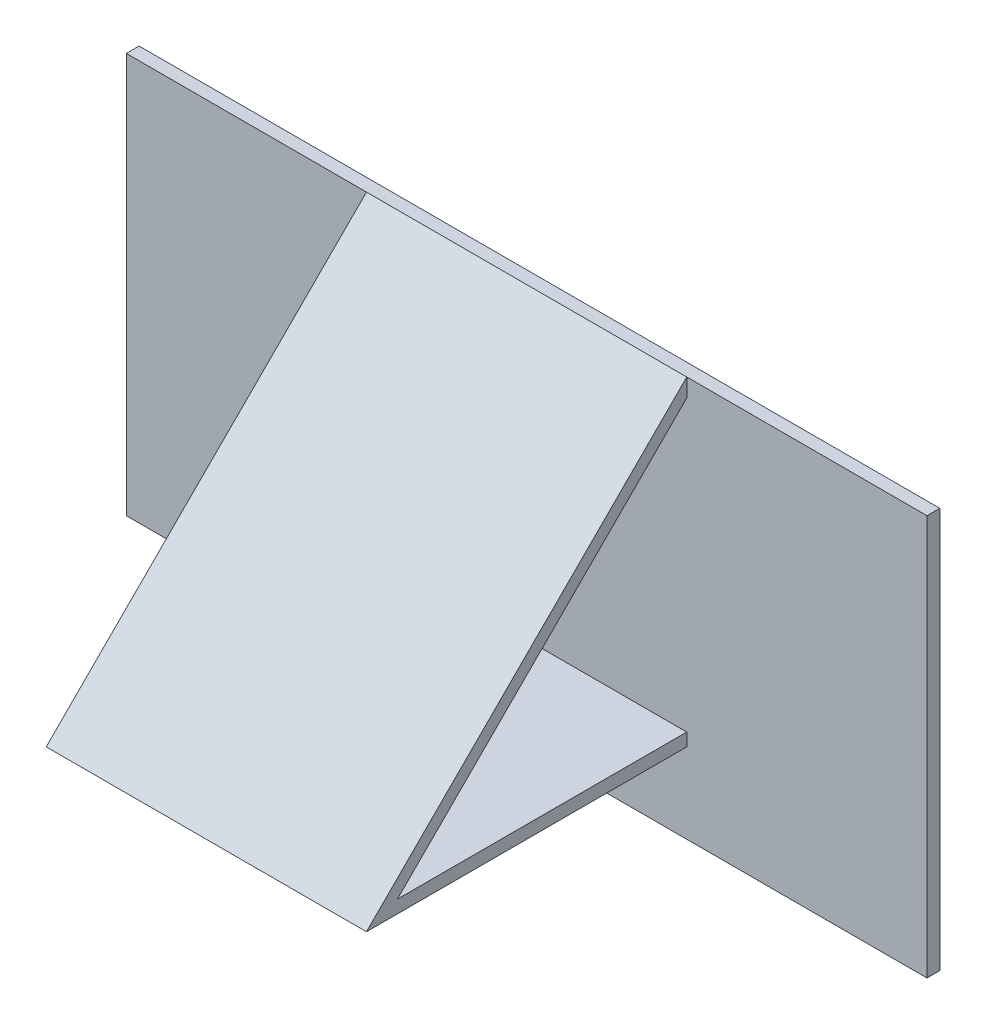
from build123d import *

# Parameters (mm, degrees)
SKIZZE1_W                       = 250
SKIZZE1_H                       = 125
AUFSATZ_LINEAR_AUSTRAGEN1_DEPTH = 4
SKIZZE2_W                       = 100
SKIZZE2_H                       = 100
AUFSATZ_LINEAR_AUSTRAGEN2_DEPTH = 100
SCHNITT_LINEAR_AUSTRAGEN1_DEPTH = 100
SCHNITT_LINEAR_AUSTRAGEN2_DEPTH = 100


with BuildPart() as part:
    # Skizze1 → Aufsatz-Linear austragen1 (new body)
    with BuildSketch(Plane.XY):
        with Locations((125, 62.5)):
            Rectangle(SKIZZE1_W, SKIZZE1_H)
    extrude(amount=AUFSATZ_LINEAR_AUSTRAGEN1_DEPTH)

    # Skizze2 → Aufsatz-Linear austragen2 (add)
    with BuildSketch(Plane.XY.offset(4)):
        with Locations((125, 75)):
            Rectangle(SKIZZE2_W, SKIZZE2_H)
    extrude(amount=AUFSATZ_LINEAR_AUSTRAGEN2_DEPTH)

    # Skizze3 → Schnitt-Linear austragen1 (cut)
    with BuildSketch(Plane.ZY.offset(-75)):
        Polygon((104, 25), (104, 125), (4, 125), align=None)
    extrude(amount=-SCHNITT_LINEAR_AUSTRAGEN1_DEPTH, mode=Mode.SUBTRACT)

    # Skizze4 → Schnitt-Linear austragen2 (cut)
    with BuildSketch(Plane.ZY.offset(-75)):
        Polygon((4, 119.343145751), (94.343145751, 29), (4, 29), align=None)
    extrude(amount=-SCHNITT_LINEAR_AUSTRAGEN2_DEPTH, mode=Mode.SUBTRACT)


solid = part.part
